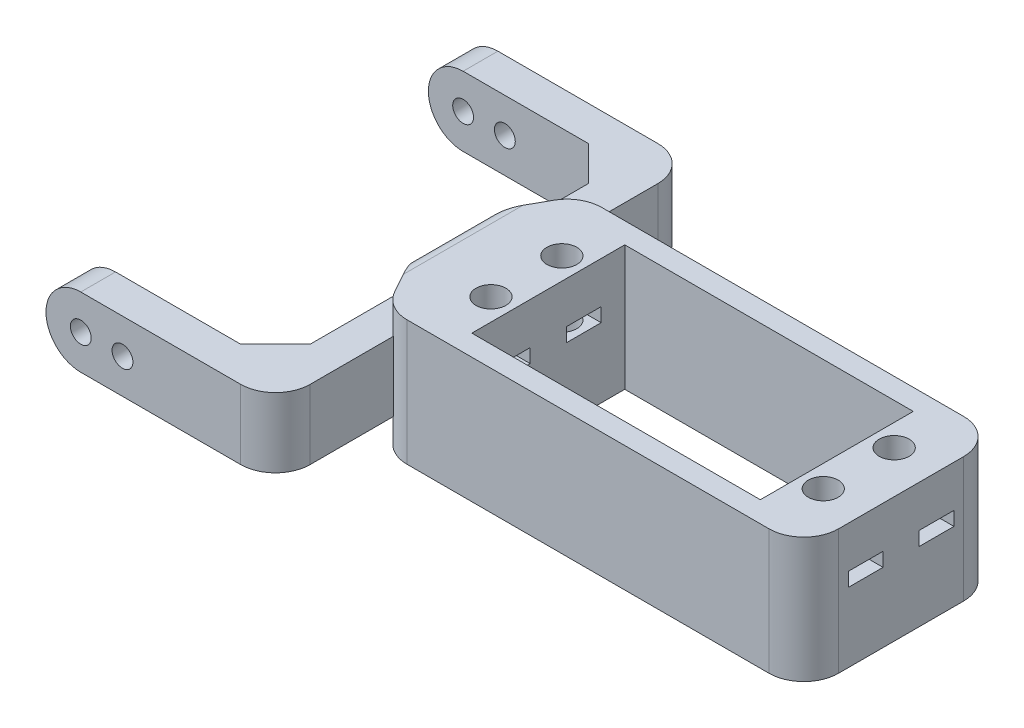
from build123d import *

# Parameters (mm, degrees)
ESQUISSE1_W                         = 60
ESQUISSE1_H                         = 18
BOSS_EXTRU_1_DEPTH                  = 28
ESQUISSE2_W                         = 41.5
ESQUISSE2_H                         = 22
ENL_V_MAT_EXTRU_1_DEPTH             = 30
ESQUISSE3_R                         = 2.15
ENL_V_MAT_EXTRU_2_DEPTH             = 30
ESQUISSE5_W                         = 10
ESQUISSE5_H                         = 60
BOSS_EXTRU_2_DEPTH                  = 5
ESQUISSE6_W                         = 10
ESQUISSE6_H                         = 5
BOSS_EXTRU_3_DEPTH                  = 28
ESQUISSE7_R                         = 1.5
ENL_V_MAT_EXTRU_4_DEPTH             = 92.394748208
NERVURE11_REACH                     = 77.186
ESQUISSE8_WALL_W                    = 162.668500034
ESQUISSE8_WALL_H                    = 18
CONG_5_R                            = 5
CONG_6_R                            = 5
NERVURE12_REACH                     = 73.169
ESQUISSE10_WALL_W                   = 151.408694602
ESQUISSE10_WALL_H                   = 10
CONG_7_R                            = 5
ESQUISSE12_W                        = 5
ESQUISSE12_H                        = 2
ENL_V_MAT_EXTRU_5_DEPTH             = 8
ENL_V_MAT_EXTRU_5_DIRECTION_2_REACH = 67.265
R_P_TITION_CIRCULAIRE1_COUNT        = 3
R_P_TITION_CIRCULAIRE1_ANGLE        = 180
ENL_V_MAT_EXTRU_8_DEPTH             = 79.064076245
ENL_V_MAT_EXTRU_8_DEPTH_BACK        = 79.064076245
CONG_8_R                            = 5
CONG_10_R                           = 5
CONG_12_R                           = 2
NERVURE13_REACH                     = 79.369
ESQUISSE22_WALL_W                   = 163.809556882
ESQUISSE22_WALL_H                   = 10
ENL_V_MAT_EXTRU_10_DEPTH            = 88.464278423
ENL_V_MAT_EXTRU_10_DEPTH_BACK       = 88.464278423
ESQUISSE24_R                        = 1.5


with BuildPart() as part:
    # Esquisse1 → Boss.-Extru.1 (new body)
    with BuildSketch(Plane.XY):
        Rectangle(ESQUISSE1_W, ESQUISSE1_H)
    extrude(amount=BOSS_EXTRU_1_DEPTH)

    # Esquisse2 → Enlèv. mat.-Extru.1 (cut)
    with BuildSketch(Plane.XZ.offset(9)):
        with Locations((0, 14)):
            Rectangle(ESQUISSE2_W, ESQUISSE2_H)
    extrude(amount=-ENL_V_MAT_EXTRU_1_DEPTH, mode=Mode.SUBTRACT)

    # Esquisse3 → Enlèv. mat.-Extru.2 (cut)
    with BuildSketch(Plane(origin=(0, -9, 0), x_dir=(-1, 0, 0), z_dir=(0, -1, 0))):
        with Locations(Location((23.9, -19.1, 0), (0, 0, 90))):
            Circle(ESQUISSE3_R)
        with Locations(Location((23.9, -8.9, 0), (0, 0, 90))):
            Circle(ESQUISSE3_R)
        with Locations(Location((-23.9, -8.9, 0), (0, 0, 90))):
            Circle(ESQUISSE3_R)
        with Locations(Location((-23.9, -19.1, 0), (0, 0, 90))):
            Circle(ESQUISSE3_R)
    extrude(amount=-ENL_V_MAT_EXTRU_2_DEPTH, mode=Mode.SUBTRACT)

    # Esquisse5 → Boss.-Extru.2 (add)
    with BuildSketch(Plane.ZY.offset(30)):
        with Locations((14, 0)):
            Rectangle(ESQUISSE5_W, ESQUISSE5_H)
    boss_extru_2 = extrude(amount=BOSS_EXTRU_2_DEPTH)

    # Esquisse6 → Boss.-Extru.3 (add)
    with BuildSketch(Plane.ZY.offset(35)):
        with Locations((14, 27.5)):
            Rectangle(ESQUISSE6_W, ESQUISSE6_H)
        with Locations((14, -27.5)):
            Rectangle(ESQUISSE6_W, ESQUISSE6_H)
    boss_extru_3 = extrude(amount=BOSS_EXTRU_3_DEPTH)

    # Esquisse7 → Enlèv. mat.-Extru.4 (cut, symmetric)
    with BuildSketch(Plane(origin=(0, 30, 0), x_dir=(1, 0, 0), z_dir=(0, 1, 0))):
        with Locations(Location((-58, -14, 0), (0, 0, 270))):
            Circle(ESQUISSE7_R)
    enl_v_mat_extru_4 = extrude(amount=ENL_V_MAT_EXTRU_4_DEPTH, both=True, mode=Mode.SUBTRACT)

    # Esquisse8 wall → Nervure11 (add, up to next)
    with BuildSketch(Plane(origin=(-32.5, 0, 23.5), x_dir=(-0.485642931179, 0, -0.874157276122), z_dir=(-0.874157276122, 0, 0.485642931179)), mode=Mode.PRIVATE) as nervure11_sk1:
        Rectangle(ESQUISSE8_WALL_W, ESQUISSE8_WALL_H)
    nervure11_tool1 = extrude(nervure11_sk1.sketch, amount=-NERVURE11_REACH, mode=Mode.PRIVATE) - part.part
    nervure11 = nervure11_tool1.solids().sort_by_distance((-32.5, 0, 23.5))[0]
    add(nervure11)

    # Symétrie1: Nervure11 across plane
    add(nervure11.mirror(Plane.XY.offset(14)))

    # Congé5
    cong_5_edges = [part.edges().sort_by_distance(p)[0] for p in [
        (-30, 0, 28),
        (30, 0, 28),
        (-30, 0, 0),
        (30, 0, 0),
    ]]
    fillet(cong_5_edges, radius=CONG_5_R)

    # Congé6
    cong_6_edges = [part.edges().sort_by_distance(p)[0] for p in [
        (-30, 30, 14),
        (-30, -30, 14),
    ]]
    fillet(cong_6_edges, radius=CONG_6_R)

    # Esquisse10 wall → Nervure12 (add, up to next)
    with BuildSketch(Plane(origin=(-37.5, 22.5, 14), x_dir=(0.707106781187, -0.707106781187, 0), z_dir=(0.707106781187, 0.707106781187, 0)), mode=Mode.PRIVATE) as nervure12_sk1:
        Rectangle(ESQUISSE10_WALL_W, ESQUISSE10_WALL_H)
    nervure12_tool1 = extrude(nervure12_sk1.sketch, amount=NERVURE12_REACH, mode=Mode.PRIVATE) - part.part
    nervure12 = nervure12_tool1.solids().sort_by_distance((-37.5, 22.5, 14))[0]
    add(nervure12)

    # Symétrie2: Nervure12 across plane
    add(nervure12.mirror(Plane.ZX))

    # Congé7
    cong_7_edges = [part.edges().sort_by_distance(p)[0] for p in [
        (-63, -27.5, 9),
        (-63, -27.5, 19),
        (-63, 27.5, 9),
        (-63, 27.5, 19),
    ]]
    fillet(cong_7_edges, radius=CONG_7_R - 0.0001)  # a hair under: the kernel refuses the full size

    # Esquisse12 → Enlèv. mat.-Extru.5 (cut)
    with BuildSketch(Plane(origin=(-20.75, 0, 0), x_dir=(0, 0, -1), z_dir=(1, 0, 0))):
        with Locations((-19.1, 2)):
            Rectangle(ESQUISSE12_W, ESQUISSE12_H)
        with Locations((-8.9, 2)):
            Rectangle(ESQUISSE12_W, ESQUISSE12_H)
    extrude(amount=-ENL_V_MAT_EXTRU_5_DEPTH, mode=Mode.SUBTRACT)

    # Esquisse12 → Enlèv. mat.-Extru.5 direction 2 (cut, up to next)
    with BuildSketch(Plane(origin=(-20.75, 0, 0), x_dir=(0, 0, -1), z_dir=(1, 0, 0)), mode=Mode.PRIVATE) as enl_v_mat_extru_5_direction_2_sk1:
        with Locations((-19.1, 2)):
            Rectangle(ESQUISSE12_W, ESQUISSE12_H)
    enl_v_mat_extru_5_direction_2_tool1 = extrude(enl_v_mat_extru_5_direction_2_sk1.sketch, amount=ENL_V_MAT_EXTRU_5_DIRECTION_2_REACH, mode=Mode.PRIVATE) & part.part
    # Esquisse12 → Enlèv. mat.-Extru.5 direction 2 (cut, up to next)
    with BuildSketch(Plane(origin=(-20.75, 0, 0), x_dir=(0, 0, -1), z_dir=(1, 0, 0)), mode=Mode.PRIVATE) as enl_v_mat_extru_5_direction_2_sk2:
        with Locations((-8.9, 2)):
            Rectangle(ESQUISSE12_W, ESQUISSE12_H)
    enl_v_mat_extru_5_direction_2_tool2 = extrude(enl_v_mat_extru_5_direction_2_sk2.sketch, amount=ENL_V_MAT_EXTRU_5_DIRECTION_2_REACH, mode=Mode.PRIVATE) & part.part
    add(enl_v_mat_extru_5_direction_2_tool1.solids().sort_by_distance((-20.75, 2, 19.1))[0], mode=Mode.SUBTRACT)
    add(enl_v_mat_extru_5_direction_2_tool2.solids().sort_by_distance((-20.75, 2, 8.9))[0], mode=Mode.SUBTRACT)

    # Répétition circulaire1: Boss.-Extru.2, Boss.-Extru.3, Enlèv. mat.-Extru.4 ×3 about axis
    r_p_tition_circulaire1_axis = Axis((-35, 0, 14), (-1, 0, 0))
    add([boss_extru_2.rotate(r_p_tition_circulaire1_axis, i * R_P_TITION_CIRCULAIRE1_ANGLE / (R_P_TITION_CIRCULAIRE1_COUNT - 1)) for i in range(1, R_P_TITION_CIRCULAIRE1_COUNT)])
    add([boss_extru_3.rotate(r_p_tition_circulaire1_axis, i * R_P_TITION_CIRCULAIRE1_ANGLE / (R_P_TITION_CIRCULAIRE1_COUNT - 1)) for i in range(1, R_P_TITION_CIRCULAIRE1_COUNT)])
    add([enl_v_mat_extru_4.rotate(r_p_tition_circulaire1_axis, i * R_P_TITION_CIRCULAIRE1_ANGLE / (R_P_TITION_CIRCULAIRE1_COUNT - 1)) for i in range(1, R_P_TITION_CIRCULAIRE1_COUNT)], mode=Mode.SUBTRACT)

    # Esquisse21 → Enlèv. mat.-Extru.8 (cut, two sides: drawn at the far end of the back side and taken through both)
    with BuildSketch(Plane(origin=(0, 0, 9), x_dir=(-1, 0, 0), z_dir=(0, 0, -1)).offset(-ENL_V_MAT_EXTRU_8_DEPTH_BACK)):
        Polygon((63, -25), (40, -25), (35, -20), (35, -9), (30, -9), (30, -30), (63, -30), align=None)
        Polygon((35, 20), (40, 25), (63, 25), (63, 30), (30, 30), (30, 9), (35, 9), align=None)
    extrude(amount=ENL_V_MAT_EXTRU_8_DEPTH + ENL_V_MAT_EXTRU_8_DEPTH_BACK, mode=Mode.SUBTRACT)

    # Congé8
    cong_8_edges = [part.edges().sort_by_distance(p)[0] for p in [
        (-30, 0, 44),
        (-30, 0, -16),
    ]]
    fillet(cong_8_edges, radius=CONG_8_R)

    # Congé10
    cong_10_edges = [part.edges().sort_by_distance(p)[0] for p in [
        (-63, 5, -13.5),
        (-63, -5, -13.5),
        (-63, -5, 41.5),
        (-63, 5, 41.5),
    ]]
    fillet(cong_10_edges, radius=CONG_10_R - 0.0001)  # a hair under: the kernel refuses the full size

    # Congé12
    cong_12_edges = [part.edges().sort_by_distance(p)[0] for p in [
        (-35, -9, 14),
        (-35, 9, 14),
    ]]
    fillet(cong_12_edges, radius=CONG_12_R)

    # Esquisse22 wall → Nervure13 (add, up to next)
    with BuildSketch(Plane(origin=(-37.5, 0, -8.5), x_dir=(0.707106781187, 0, 0.707106781187), z_dir=(0.707106781187, 0, -0.707106781187)), mode=Mode.PRIVATE) as nervure13_sk1:
        Rectangle(ESQUISSE22_WALL_W, ESQUISSE22_WALL_H)
    nervure13_tool1 = extrude(nervure13_sk1.sketch, amount=NERVURE13_REACH, mode=Mode.PRIVATE) - part.part
    nervure13 = nervure13_tool1.solids().sort_by_distance((-37.5, 0, -8.5))[0]
    add(nervure13)

    # Symétrie3: Nervure13 across plane
    add(nervure13.mirror(Plane(origin=(0, 0, 14), x_dir=(1, 0, 0), z_dir=(0, 0, -1))))

    # Esquisse24 → Enlèv. mat.-Extru.10 (cut, two sides: drawn at the far end of the back side and taken through both)
    with BuildSketch(Plane(origin=(0, 0, -16), x_dir=(-1, 0, 0), z_dir=(0, 0, -1)).offset(-ENL_V_MAT_EXTRU_10_DEPTH_BACK)):
        with Locations(Location((52, 0, 0), (0, 0, 90))):
            Circle(ESQUISSE24_R)
    extrude(amount=ENL_V_MAT_EXTRU_10_DEPTH + ENL_V_MAT_EXTRU_10_DEPTH_BACK, mode=Mode.SUBTRACT)


solid = part.part
